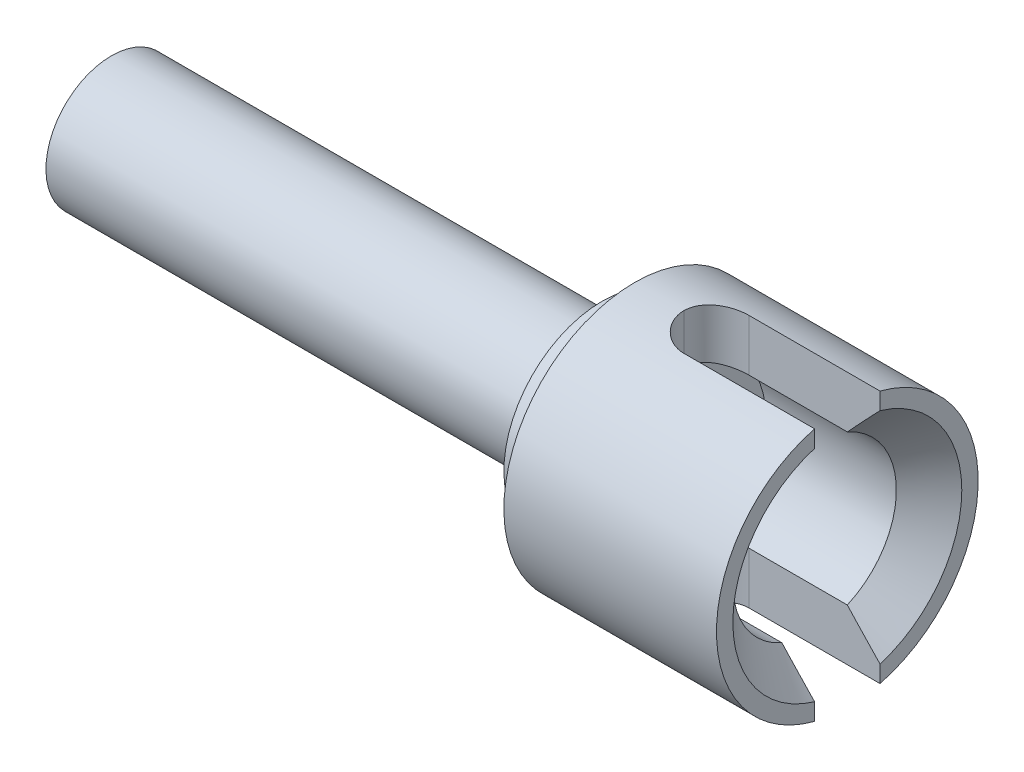
from build123d import *

# Parameters (mm, degrees)
SKETCH1_W               = 25.4
SKETCH1_H               = 3.175
SKETCH1_W_2             = 1.5875
SKETCH1_H_2             = 1.5875
SKETCH1_W_3             = 7.9375
SKETCH1_H_3             = 2.38125
CUT_EXTRUDE1_DEPTH      = 27.940768363
CUT_EXTRUDE1_DEPTH_BACK = 27.940768363
SKETCH2_W               = 0.79375
SKETCH2_H               = 3.175
SKETCH2_R               = 1.5875
FILLET1_R               = 1.5875
CHAMFER1_SIZE           = 1.5875


with BuildPart() as part:
    # Sketch1 → Revolve1 (revolve)
    with BuildSketch(Plane.XY):
        with Locations((-12.7, 1.5875)):
            Rectangle(SKETCH1_W, SKETCH1_H)
        with Locations((-0.79375, 3.96875)):
            Rectangle(SKETCH1_W_2, SKETCH1_H_2)
        Polygon((0, 3.175), (0, 0), (2.38125, 0), (2.38125, 3.96875), (2.38125, 6.35), (0, 6.35), (0, 4.7625), align=None)
        with Locations((6.35, 5.159375)):
            Rectangle(SKETCH1_W_3, SKETCH1_H_3)
    revolve(axis=Axis((0, 0, 0), (-1, 0, 0)))

    # Sketch2 → Cut-Extrude1 (cut, two sides: drawn at the far end of the back side and taken through both)
    with BuildSketch(Plane(origin=(0, 0, 0), x_dir=(1, 0, 0), z_dir=(0, 1, 0)).offset(-CUT_EXTRUDE1_DEPTH_BACK)):
        with Locations((2.778125, 0)):
            Rectangle(SKETCH2_W, SKETCH2_H)
        with BuildLine():
            Line((3.175, -1.5875), (6.35, -1.5875))
            ThreePointArc((6.35, -1.5875), (4.7625, 0), (6.35, 1.5875))
            Line((6.35, 1.5875), (3.175, 1.5875))
            Line((3.175, 1.5875), (3.175, -1.5875))
        make_face()
        with Locations((6.35, 0)):
            Circle(SKETCH2_R)
        with BuildLine():
            Line((6.35, -1.5875), (10.31875, -1.5875))
            Line((10.31875, -1.5875), (10.31875, 1.5875))
            Line((10.31875, 1.5875), (6.35, 1.5875))
            ThreePointArc((6.35, 1.5875), (7.472532015, 1.122532015), (7.9375, 0))
            ThreePointArc((7.9375, 0), (7.472532015, -1.122532015), (6.35, -1.5875))
        make_face()
    extrude(amount=CUT_EXTRUDE1_DEPTH + CUT_EXTRUDE1_DEPTH_BACK, mode=Mode.SUBTRACT)

    # Fillet1
    fillet1_edges = [part.edges().sort_by_distance(p)[0] for p in [
        (2.38125, -4.89289026, -1.5875),
        (2.38125, 4.89289026, -1.5875),
        (2.38125, -4.89289026, 1.5875),
        (2.38125, 4.89289026, 1.5875),
    ]]
    fillet(fillet1_edges, radius=FILLET1_R - 0.0001)  # a hair under: the kernel refuses the full size

    # Chamfer1
    chamfer1_edges = [part.edges().sort_by_distance(p)[0] for p in [
        (10.31875, 0, 3.96875),
        (10.31875, 0, -3.96875),
    ]]
    chamfer(chamfer1_edges, length=CHAMFER1_SIZE)


solid = part.part
